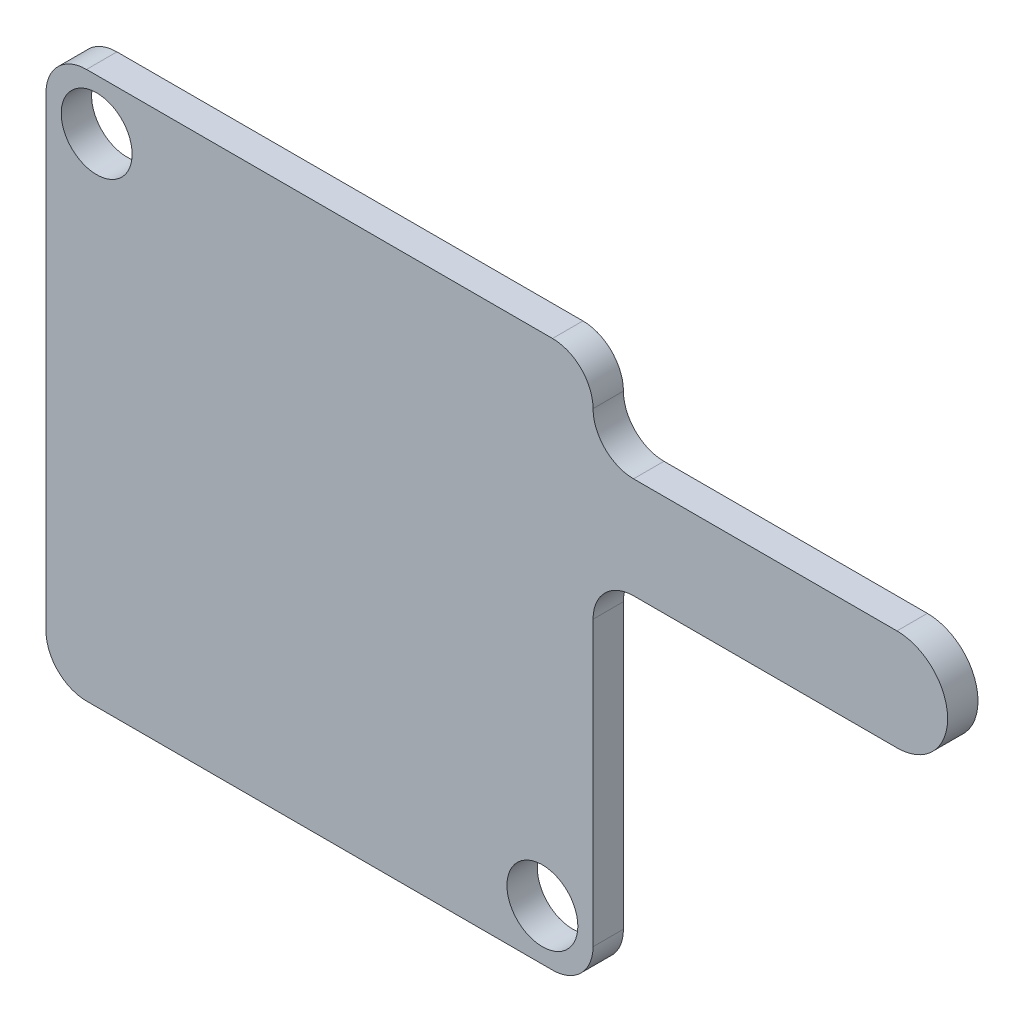
from build123d import *

# Parameters (mm, degrees)
ESQUISSE1_R        = 1.75
BOSS_EXTRU_1_DEPTH = 1.5
CONG_1_R           = 2


with BuildPart() as part:
    # Esquisse1 → Boss.-Extru.1 (new body)
    with BuildSketch(Plane.XY):
        with BuildLine():
            Line((0, 0), (27, 0))
            Line((27, 0), (27, 18))
            Line((27, 18), (42, 18))
            ThreePointArc((42, 18), (44.5, 20.5), (42, 23))
            Line((42, 23), (27, 23))
            Line((27, 23), (27, 27))
            Line((27, 27), (0, 27))
            Line((0, 27), (0, 0))
        make_face()
        with Locations((2.5, 24.5)):
            Circle(ESQUISSE1_R, mode=Mode.SUBTRACT)
        with Locations((24.5, 2.5)):
            Circle(ESQUISSE1_R, mode=Mode.SUBTRACT)
    extrude(amount=BOSS_EXTRU_1_DEPTH)

    # Congé1
    cong_1_edges = [part.edges().sort_by_distance(p)[0] for p in [
        (27, 23, 0.75),
        (27, 18, 0.75),
        (27, 0, 0.75),
        (0, 0, 0.75),
        (0, 27, 0.75),
        (27, 27, 0.75),
    ]]
    fillet(cong_1_edges, radius=CONG_1_R - 0.0001)  # a hair under: the kernel refuses the full size


solid = part.part
